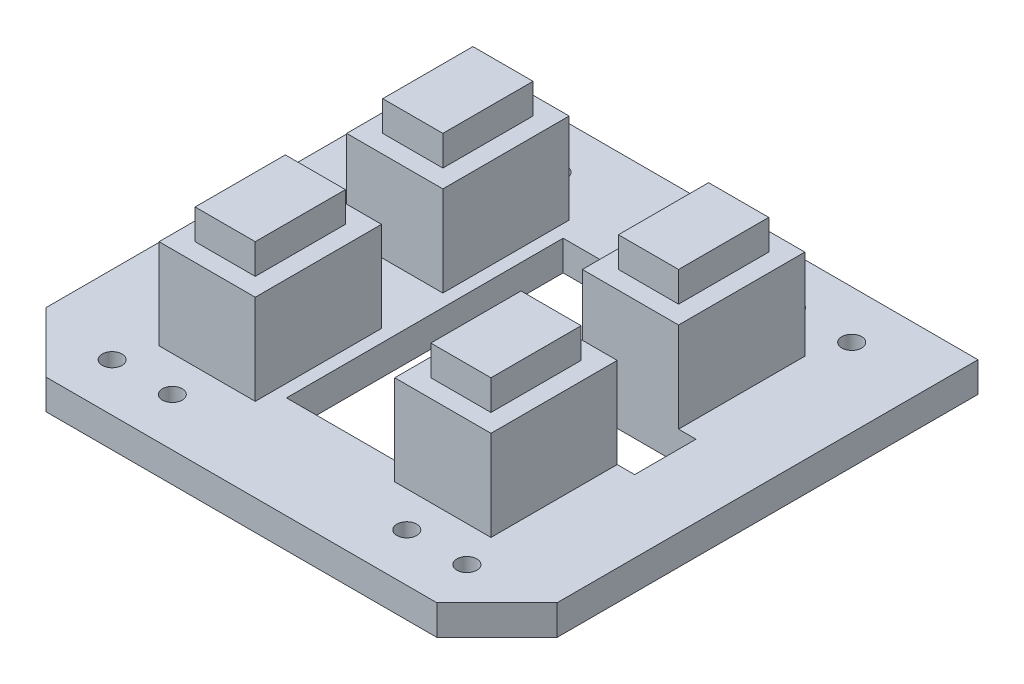
from build123d import *

# Parameters (mm, degrees)
SKETCH1_R           = 1.65
SKETCH1_W           = 19
SKETCH1_H           = 46
BOSS_EXTRUDE3_DEPTH = 5
CHAMFER1_SIZE       = 10
SKETCH6_W           = 10
SKETCH6_H           = 15
BOSS_EXTRUDE4_DEPTH = 20
SKETCH8_W           = 16
SKETCH8_H           = 21
SKETCH8_W_2         = 10
SKETCH8_H_2         = 15
BOSS_EXTRUDE5_DEPTH = 15
SKETCH5_W           = 16
SKETCH5_H           = 10.2
CUT_EXTRUDE1_DEPTH  = 64.492125496


with BuildPart() as part:
    # Sketch1 → Boss-Extrude3 (new body)
    with BuildSketch(Plane(origin=(0, 0, 0), x_dir=(1, 0, 0), z_dir=(0, 1, 0))):
        Polygon((42.5, 40), (-42.5, 40), (-42.5, 24.25), (-42.5, -24.25), (-42.5, -40), (-20, -40), (20, -40), (42.5, -40), (42.5, -24.25), (42.5, 24.25), align=None)
        with Locations((-29.5, -32)):
            Circle(SKETCH1_R, mode=Mode.SUBTRACT)
        with Locations((-19.5, -32)):
            Circle(SKETCH1_R, mode=Mode.SUBTRACT)
        with Locations((19.5, -32)):
            Circle(SKETCH1_R, mode=Mode.SUBTRACT)
        with Locations((29.5, -32)):
            Circle(SKETCH1_R, mode=Mode.SUBTRACT)
        Rectangle(SKETCH1_W, SKETCH1_H, mode=Mode.SUBTRACT)
        with Locations((-29.5, 32)):
            Circle(SKETCH1_R, mode=Mode.SUBTRACT)
        with Locations((-19.5, 32)):
            Circle(SKETCH1_R, mode=Mode.SUBTRACT)
        with Locations((19.5, 32)):
            Circle(SKETCH1_R, mode=Mode.SUBTRACT)
        with Locations((29.5, 32)):
            Circle(SKETCH1_R, mode=Mode.SUBTRACT)
    extrude(amount=BOSS_EXTRUDE3_DEPTH)

    # Chamfer1
    chamfer1_edges = [part.edges().sort_by_distance(p)[0] for p in [
        (-42.5, 2.5, 40),
        (42.5, 2.5, 40),
    ]]
    chamfer(chamfer1_edges, length=CHAMFER1_SIZE)

    # Sketch6 → Boss-Extrude4 (add)
    with BuildSketch(Plane(origin=(0, 5, 0), x_dir=(1, 0, 0), z_dir=(0, 1, 0))):
        with Locations((-19.6, 15.6)):
            Rectangle(SKETCH6_W, SKETCH6_H)
        with Locations((19.6, 15.6)):
            Rectangle(SKETCH6_W, SKETCH6_H)
        with Locations((19.6, -15.6)):
            Rectangle(SKETCH6_W, SKETCH6_H)
        with Locations((-19.6, -15.6)):
            Rectangle(SKETCH6_W, SKETCH6_H)
    extrude(amount=BOSS_EXTRUDE4_DEPTH)

    # Sketch8 → Boss-Extrude5 (add)
    # profile 1 of 4: a face of its own
    with BuildSketch(Plane(origin=(0, 5, 0), x_dir=(1, 0, 0), z_dir=(0, 1, 0))):
        with Locations((-19.6, 15.6)):
            Rectangle(SKETCH8_W, SKETCH8_H)
        with Locations((-19.6, 15.6)):
            Rectangle(SKETCH8_W_2, SKETCH8_H_2, mode=Mode.SUBTRACT)
    # profile 2 of 4: a face of its own
    with BuildSketch(Plane(origin=(0, 5, 0), x_dir=(1, 0, 0), z_dir=(0, 1, 0))):
        with Locations((-19.6, -15.6)):
            Rectangle(SKETCH8_W, SKETCH8_H)
        with Locations((-19.6, -15.6)):
            Rectangle(SKETCH8_W_2, SKETCH8_H_2, mode=Mode.SUBTRACT)
    # profile 3 of 4: a face of its own
    with BuildSketch(Plane(origin=(0, 5, 0), x_dir=(1, 0, 0), z_dir=(0, 1, 0))):
        with Locations((19.6, 15.6)):
            Rectangle(SKETCH8_W, SKETCH8_H)
        with Locations((19.6, 15.6)):
            Rectangle(SKETCH8_W_2, SKETCH8_H_2, mode=Mode.SUBTRACT)
    # profile 4 of 4: a face of its own
    with BuildSketch(Plane(origin=(0, 5, 0), x_dir=(1, 0, 0), z_dir=(0, 1, 0))):
        with Locations((19.6, -15.6)):
            Rectangle(SKETCH8_W, SKETCH8_H)
        with Locations((19.6, -15.6)):
            Rectangle(SKETCH8_W_2, SKETCH8_H_2, mode=Mode.SUBTRACT)
    extrude(amount=BOSS_EXTRUDE5_DEPTH)

    # Sketch5 → Cut-Extrude1 (cut, through all)
    with BuildSketch(Plane.XZ):
        with Locations((22.5, 0)):
            Rectangle(SKETCH5_W, SKETCH5_H)
    extrude(amount=-CUT_EXTRUDE1_DEPTH, mode=Mode.SUBTRACT)


solid = part.part
